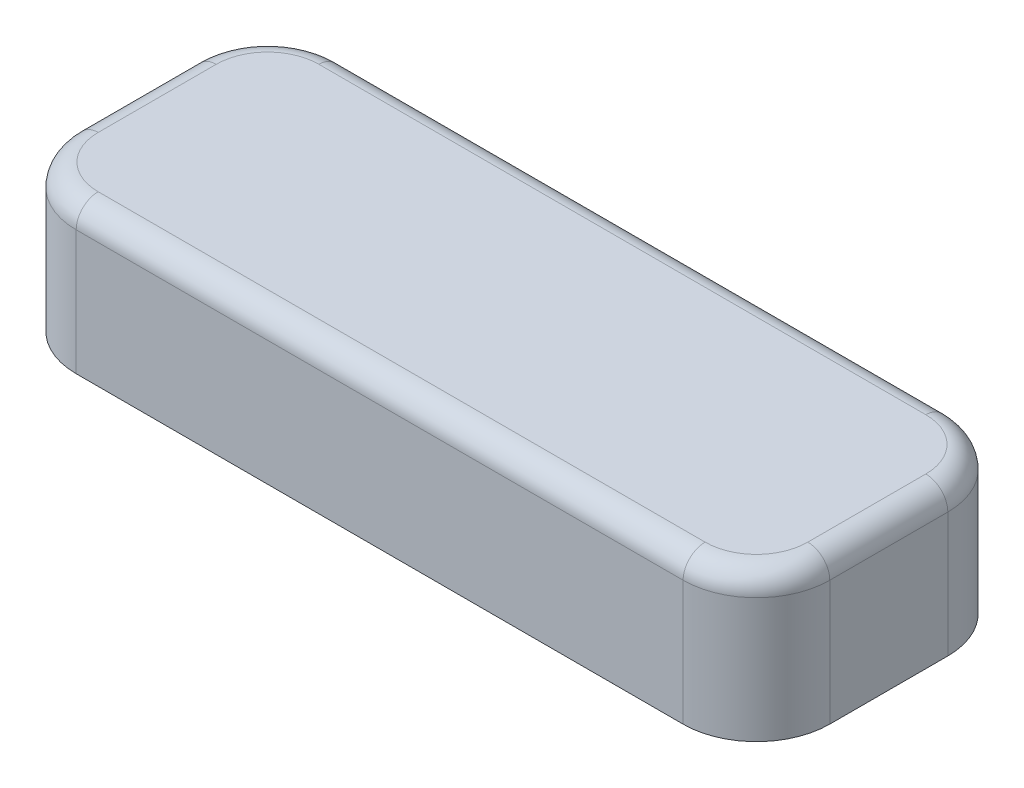
from build123d import *

# Parameters (mm, degrees)
SKETCH_1_R        = 2.8
EXTRUDE_1_DEPTH   = 8
EXTRUDE_1_2_DEPTH = 8
EXTRUDE_1_3_DEPTH = 8
SKETCH_2_W        = 51.3875
SKETCH_2_H        = 18.05
EXTRUDE_2_DEPTH   = 1
SKETCH_3_W        = 51.3875
SKETCH_3_H        = 18.05
SKETCH_3_W_2      = 49.3875
SKETCH_3_H_2      = 16.05
EXTRUDE_3_DEPTH   = 9
SKETCH_4_W        = 7.50625
SKETCH_4_H        = 1.2
SKETCH_4_W_2      = 1.2
SKETCH_4_H_2      = 5.825
SKETCH_4_W_3      = 10.5875
EXTRUDE_4_DEPTH   = 2.5
FILLET_1_R        = 5
FILLET_2_R        = 1.5


with BuildPart() as part:
    # 草图1 → 凸台-拉伸1 (new body)
    with BuildSketch(Plane(origin=(0, 0, 0), x_dir=(1, 0, 0), z_dir=(0, 1, 0))):
        Circle(SKETCH_1_R)
        Polygon((2.2, 0.6), (2.2, -0.6), (0.6, -0.6), (0.6, -2.2), (-0.6, -2.2), (-0.6, -0.6), (-2.2, -0.6), (-2.2, 0.6), (-0.6, 0.6), (-0.6, 2.2), (0.6, 2.2), (0.6, 0.6), align=None, mode=Mode.SUBTRACT)
    extrude(amount=-EXTRUDE_1_DEPTH)

    # 草图2 → 凸台-拉伸2 (add)
    with BuildSketch(Plane(origin=(0, 0, 0), x_dir=(1, 0, 0), z_dir=(0, 1, 0))):
        Rectangle(SKETCH_2_W, SKETCH_2_H)
    extrude(amount=EXTRUDE_2_DEPTH)

    # 草图3 → 凸台-拉伸3 (add)
    with BuildSketch(Plane(origin=(0, 0, 0), x_dir=(1, 0, 0), z_dir=(0, 1, 0))):
        Rectangle(SKETCH_3_W, SKETCH_3_H)
        Rectangle(SKETCH_3_W_2, SKETCH_3_H_2, mode=Mode.SUBTRACT)
    extrude(amount=-EXTRUDE_3_DEPTH)



with BuildPart() as body_2:
    # 草图1 → Extrude 1 2 (new body)
    with BuildSketch(Plane(origin=(0, 0, 0), x_dir=(1, 0, 0), z_dir=(0, 1, 0))):
        with Locations((-11.90625, 0)):
            Circle(SKETCH_1_R)
        Polygon((-14.10625, -0.6), (-14.10625, 0.6), (-12.50625, 0.6), (-12.50625, 2.2), (-11.30625, 2.2), (-11.30625, 0.6), (-9.70625, 0.6), (-9.70625, -0.6), (-11.30625, -0.6), (-11.30625, -2.2), (-12.50625, -2.2), (-12.50625, -0.6), align=None, mode=Mode.SUBTRACT)
    extrude(amount=-EXTRUDE_1_2_DEPTH)


with BuildPart() as body_3:
    # 草图1 → Extrude 1 3 (new body)
    with BuildSketch(Plane(origin=(0, 0, 0), x_dir=(1, 0, 0), z_dir=(0, 1, 0))):
        with Locations((11.90625, 0)):
            Circle(SKETCH_1_R)
        Polygon((9.70625, 0.6), (9.70625, -0.6), (11.30625, -0.6), (11.30625, -2.2), (12.50625, -2.2), (12.50625, -0.6), (14.10625, -0.6), (14.10625, 0.6), (12.50625, 0.6), (12.50625, 2.2), (11.30625, 2.2), (11.30625, 0.6), align=None, mode=Mode.SUBTRACT)
    extrude(amount=-EXTRUDE_1_3_DEPTH)


with BuildPart() as part_1:
    add(part.part)

    add(body_2.part)  # 凸台-拉伸4 merges body 2

    add(body_3.part)  # 凸台-拉伸4 merges body 3
    # 草图4 → 凸台-拉伸4 (add)
    with BuildSketch(Plane(origin=(0, 0, 0), x_dir=(1, 0, 0), z_dir=(0, 1, 0))):
        with Locations((5.953125, 0)):
            Rectangle(SKETCH_4_W, SKETCH_4_H)
        with Locations((11.90625, 5.1125)):
            Rectangle(SKETCH_4_W_2, SKETCH_4_H_2)
        with Locations((11.90625, -5.1125)):
            Rectangle(SKETCH_4_W_2, SKETCH_4_H_2)
        with Locations((19.4, 0)):
            Rectangle(SKETCH_4_W_3, SKETCH_4_H)
        with Locations((0, 5.1125)):
            Rectangle(SKETCH_4_W_2, SKETCH_4_H_2)
        with Locations((-5.953125, 0)):
            Rectangle(SKETCH_4_W, SKETCH_4_H)
        with Locations((0, -5.1125)):
            Rectangle(SKETCH_4_W_2, SKETCH_4_H_2)
        with Locations((-11.90625, 5.1125)):
            Rectangle(SKETCH_4_W_2, SKETCH_4_H_2)
        with Locations((-11.90625, -5.1125)):
            Rectangle(SKETCH_4_W_2, SKETCH_4_H_2)
        with Locations((-19.4, 0)):
            Rectangle(SKETCH_4_W_3, SKETCH_4_H)
    extrude(amount=-EXTRUDE_4_DEPTH)

    # 圆角1
    fillet_1_edges = [part_1.edges().sort_by_distance(p)[0] for p in [
        (-25.69375, -4, -9.025),
        (25.69375, -4, -9.025),
        (25.69375, -4, 9.025),
        (-25.69375, -4, 9.025),
        (-24.69375, -4.5, -8.025),
        (24.69375, -4.5, -8.025),
        (24.69375, -4.5, 8.025),
        (-24.69375, -4.5, 8.025),
    ]]
    fillet(fillet_1_edges, radius=FILLET_1_R)

    # 圆角2
    fillet_2_edges = [part_1.edges().sort_by_distance(p)[0] for p in [
        (24.69375, 0, 1.8125),
        (16.1, 0, 8.025),
        (16.1, 0, -8.025),
        (24.69375, 0, -1.8125),
        (-24.69375, 0, -1.8125),
        (-16.1, 0, -8.025),
        (-16.1, 0, 8.025),
        (-24.69375, 0, 1.8125),
        (24.229283906, 1, -7.560533906),
        (25.69375, 1, 0),
        (24.229283906, 1, 7.560533906),
        (0, 1, 9.025),
        (-24.229283906, 1, 7.560533906),
        (-25.69375, 1, 0),
        (-24.229283906, 1, -7.560533906),
        (0, 1, -9.025),
        (5.953125, 0, -8.025),
        (-5.953125, 0, -8.025),
        (-5.953125, 0, 8.025),
        (5.953125, 0, 8.025),
        (23.229283906, 0, 6.560533906),
        (23.229283906, 0, -6.560533906),
        (-23.229283906, 0, -6.560533906),
        (-23.229283906, 0, 6.560533906),
    ]]
    fillet(fillet_2_edges, radius=FILLET_2_R)


solid = part_1.part
